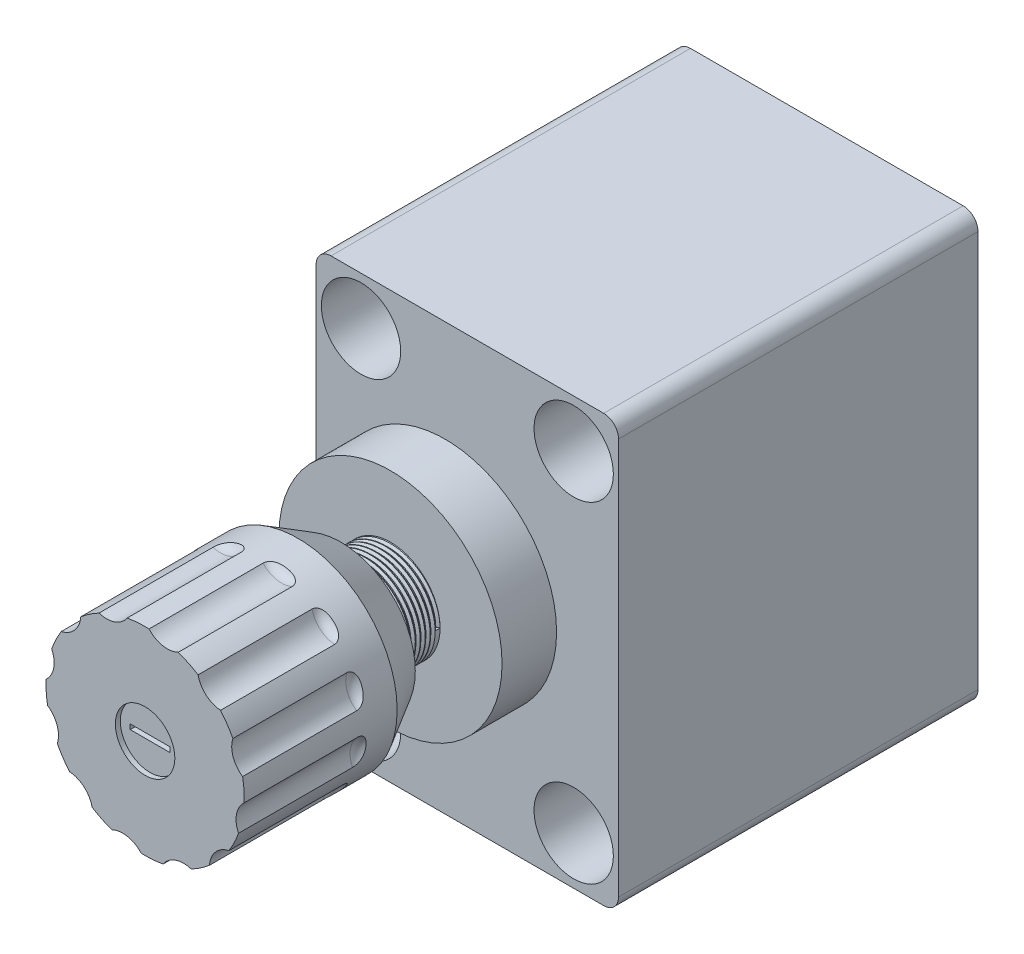
from build123d import *

# Parameters (mm, degrees)
SKETCH_1_W                       = 61
SKETCH_1_H                       = 86
SKETCH_1_R                       = 5
SKETCH_1_R_2                     = 6
SKETCH_1_R_3                     = 3.75
EXTRUDE_1_DEPTH                  = 72.5
SKETCH_3_R                       = 6
SKETCH_3_R_2                     = 3.75
EXTRUDE_2_DEPTH                  = 30
SKETCH_2_R                       = 8
CUT_EXTRUDE_1_DEPTH              = 12
FILLET_1_R                       = 3
SKETCH_7_R                       = 6
CUT_EXTRUDE_2_DEPTH              = 1
SKETCH_8_W                       = 8
SKETCH_8_H                       = 1
CUT_EXTRUDE_3_DEPTH              = 2
THREAD_1_PITCH                   = 1
CUT_EXTRUDE_4_DEPTH              = 25
FILLET_2_R                       = 2
PATTERN_CIRCULAR_1_COUNT         = 12
FILLET_2_OF_PATTERN_CIRCULAR_1_R = 2


with BuildPart() as part:
    # Sketch 1 → 凸台-拉伸1 (new body)
    with BuildSketch(Plane.XY):
        Rectangle(SKETCH_1_W, SKETCH_1_H)
        with Locations((-21.45, 33.35)):
            Circle(SKETCH_1_R, mode=Mode.SUBTRACT)
        with Locations((21.45, 33.35)):
            Circle(SKETCH_1_R, mode=Mode.SUBTRACT)
        with Locations((21.45, -33.35)):
            Circle(SKETCH_1_R, mode=Mode.SUBTRACT)
        with Locations((-21.45, -33.35)):
            Circle(SKETCH_1_R, mode=Mode.SUBTRACT)
        with Locations((-14.35, 0.05)):
            Circle(SKETCH_1_R_2, mode=Mode.SUBTRACT)
        with Locations((14.25, 0.05)):
            Circle(SKETCH_1_R_2, mode=Mode.SUBTRACT)
        with Locations((10.35, -33.35)):
            Circle(SKETCH_1_R_3, mode=Mode.SUBTRACT)
    extrude(amount=-EXTRUDE_1_DEPTH)

    # 草图3 → 凸台-拉伸2 (add)
    with BuildSketch(Plane.XY):
        with Locations((-14.35, 0.05)):
            Circle(SKETCH_3_R)
        with Locations((14.25, 0.05)):
            Circle(SKETCH_3_R)
        with Locations((10.35, -33.35)):
            Circle(SKETCH_3_R_2)
    extrude(amount=-EXTRUDE_2_DEPTH)

    # 草图2 → 切除-拉伸1 (cut)
    with BuildSketch(Plane.XY):
        with Locations((-21.45, 33.35)):
            Circle(SKETCH_2_R)
        with Locations((-21.45, -33.35)):
            Circle(SKETCH_2_R)
        with Locations((21.45, -33.35)):
            Circle(SKETCH_2_R)
        with Locations((21.45, 33.35)):
            Circle(SKETCH_2_R)
    extrude(amount=-CUT_EXTRUDE_1_DEPTH, mode=Mode.SUBTRACT)

    # 草图5 → 旋转1 (revolve)
    with BuildSketch(Plane(origin=(0, 0, 0), x_dir=(0, 0, -1), z_dir=(0, 1, 0))):
        Polygon((0, -18), (-11, -18), (-11, -5.5), (-21, -5.5), (-21, -10.5), (-29.660254038, -15.5), (-60.5, -15.5), (-60.5, 4.5), (0, 4.5), align=None)
    revolve(axis=Axis((-4.5, 0, 85.206195198), (0, 0, -1)))

    # 圆角1
    fillet_1_edges = [part.edges().sort_by_distance(p)[0] for p in [
        (30.5, -43, -36.25),
        (-30.5, -43, -36.25),
        (-30.5, 43, -36.25),
        (30.5, 43, -36.25),
    ]]
    fillet(fillet_1_edges, radius=FILLET_1_R)

    # 草图7 → 切除-拉伸2 (cut)
    with BuildSketch(Plane.XY.offset(60.5)):
        with Locations((-4.5, 0)):
            Circle(SKETCH_7_R)
    extrude(amount=-CUT_EXTRUDE_2_DEPTH, mode=Mode.SUBTRACT)

    # 草图8 → 切除-拉伸3 (cut)
    with BuildSketch(Plane.XY.offset(59.5)):
        with Locations((-4.5, 0)):
            Rectangle(SKETCH_8_W, SKETCH_8_H)
    extrude(amount=-CUT_EXTRUDE_3_DEPTH, mode=Mode.SUBTRACT)

    # 螺纹线1: the profile of Sketch 1 2 profile screwed along a right-hand helix of 15 turns, 8 arcs to a turn; built about Z, then put on its axis
    thread_1_z = Axis((0, 0, 0), (0, 0, 1))
    thread_1_corners = [(10.0003, 0, -0.000173205), (10.0003, 0, 0.875173202), (9.458734125, 0, 0.562499999), (9.458734125, 0, 0.312499999)]
    with BuildLine(mode=Mode.PRIVATE) as thread_1_profile:
        Line(thread_1_corners[0], thread_1_corners[1])
        Line(thread_1_corners[1], thread_1_corners[2])
        Line(thread_1_corners[2], thread_1_corners[3])
        Line(thread_1_corners[3], thread_1_corners[0])
    thread_1_cap = Face(thread_1_profile.wire())
    thread_1_turn_angles = [0, 22.5, 45, 67.5, 90, 112.5, 135, 157.5, 180, 202.5, 225, 247.5, 270, 292.5, 315, 337.5, 360]
    thread_1_turn_weights = [1, 0.9238795325112867, 1, 0.9238795325112867, 1, 0.9238795325112867, 1, 0.9238795325112867, 1, 0.9238795325112867, 1, 0.9238795325112867, 1, 0.9238795325112867, 1, 0.9238795325112867, 1]
    thread_1_turn_rails = [Edge.make_bspline([Vector(p[0], p[1], 0).rotate(thread_1_z, thread_1_turn_angles[k]) / thread_1_turn_weights[k] + Vector(0, 0, p[2] + THREAD_1_PITCH * thread_1_turn_angles[k] / 360) for k in range(17)], [0, 0, 0, 1, 1, 2, 2, 3, 3, 4, 4, 5, 5, 6, 6, 7, 7, 8, 8, 8], 2, thread_1_turn_weights) for p in thread_1_corners]
    thread_1_turn_sides = [Face.make_surface_from_curves(thread_1_turn_rails[p[0]], thread_1_turn_rails[p[1]]) for p in [(0, 1), (1, 2), (2, 3), (3, 0)]]
    thread_1 = Plane(origin=(-4.5, 0, 11), x_dir=(1, 0, 0), z_dir=(0, 0, 1)) * Solid(Shell([*[p.moved(Location((0, 0, THREAD_1_PITCH * i))) for i in range(15) for p in thread_1_turn_sides], thread_1_cap, thread_1_cap.rotate(thread_1_z, 5400).moved(Location((0, 0, THREAD_1_PITCH * 5400 / 360)))]))
    add(thread_1, mode=Mode.SUBTRACT)

    # 草图9 → 切除-拉伸4 (cut)
    with BuildSketch(Plane.XY.offset(60.5)):
        with BuildLine():
            ThreePointArc((-3.702905338, 19.98410969), (-0.946423196, 18.434333512), (2.188628224, 18.848401855))
            ThreePointArc((2.188628224, 18.848401855), (-0.714307216, 19.638445207), (-3.702905338, 19.98410969))
        make_face()
    cut_extrude_4 = extrude(amount=-CUT_EXTRUDE_4_DEPTH, mode=Mode.SUBTRACT)

    # 圆角2
    # the kernel refuses this fillet: 2 mm, written as the material it adds along each edge
    with BuildSketch(Plane(origin=(0, 23.343944814, 35.5), x_dir=(-0.9655082400166618, 0.260372499430965, 0), z_dir=(0.260372499430965, 0.9655082400166618, 0))) as fillet_2_piece_1_section:
        with BuildLine():
            CenterArc((5 - FILLET_2_R, FILLET_2_R), FILLET_2_R, 270, 90)
            Line((5 - FILLET_2_R, 0), (5, 0))
            Line((5, 0), (5, FILLET_2_R))
        make_face()
    fillet_2_piece_1 = revolve(axis=Axis((0, 23.343944814, 35.5), (0, 0, 1)), revolution_arc=188.362253144, mode=Mode.PRIVATE)
    fillet_2_piece_1 = fillet_2_piece_1 & Plane(origin=(-4.5, 0, 36.04735662), x_dir=(1, 0, 0), z_dir=(0, 0, 1)) * Cylinder(20, 21, mode=Mode.PRIVATE)
    add(fillet_2_piece_1)

    # 阵列(圆周)1: 切除-拉伸4 ×12 about axis
    pattern_circular_1_axis = Axis((-4.5, 0, 0), (0, 0, 1))
    for i in range(1, PATTERN_CIRCULAR_1_COUNT):
        add(cut_extrude_4.rotate(pattern_circular_1_axis, i * 360 / PATTERN_CIRCULAR_1_COUNT), mode=Mode.SUBTRACT)

    # 圆角2 of 阵列(圆周)1
    # the kernel refuses this fillet: 2 mm, written as the material it adds along each edge
    with BuildSketch(Plane(origin=(-12.27485809, 22.466449233, 35.5), x_dir=(-0.966340913133115, -0.2572649210542656, 0), z_dir=(-0.2572649210542656, 0.966340913133115, 0))) as fillet_2_of_pattern_circular_1_piece_1_section:
        with BuildLine():
            CenterArc((5 - FILLET_2_OF_PATTERN_CIRCULAR_1_R, FILLET_2_OF_PATTERN_CIRCULAR_1_R), FILLET_2_OF_PATTERN_CIRCULAR_1_R, 270, 90)
            Line((5 - FILLET_2_OF_PATTERN_CIRCULAR_1_R, 0), (5, 0))
            Line((5, 0), (5, FILLET_2_OF_PATTERN_CIRCULAR_1_R))
        make_face()
    fillet_2_of_pattern_circular_1_piece_1 = revolve(axis=Axis((-12.27485809, 22.466449233, 35.5), (0, 0, 1)), revolution_arc=188.362253144, mode=Mode.PRIVATE)
    fillet_2_of_pattern_circular_1_piece_1 = fillet_2_of_pattern_circular_1_piece_1 & Plane(origin=(-4.5, 0, 36.047356638), x_dir=(1, 0, 0), z_dir=(0, 0, 1)) * Cylinder(20, 21, mode=Mode.PRIVATE)
    add(fillet_2_of_pattern_circular_1_piece_1)
    with BuildSketch(Plane(origin=(-22.466449233, 15.569086724, 35.5), x_dir=(-0.7082433189623968, -0.7059684137021492, 0), z_dir=(-0.7059684137021492, 0.7082433189623968, 0))) as fillet_2_of_pattern_circular_1_piece_2_section:
        with BuildLine():
            CenterArc((5 - FILLET_2_OF_PATTERN_CIRCULAR_1_R, FILLET_2_OF_PATTERN_CIRCULAR_1_R), FILLET_2_OF_PATTERN_CIRCULAR_1_R, 270, 90)
            Line((5 - FILLET_2_OF_PATTERN_CIRCULAR_1_R, 0), (5, 0))
            Line((5, 0), (5, FILLET_2_OF_PATTERN_CIRCULAR_1_R))
        make_face()
    fillet_2_of_pattern_circular_1_piece_2 = revolve(axis=Axis((-22.466449233, 15.569086724, 35.5), (0, 0, 1)), revolution_arc=188.362253144, mode=Mode.PRIVATE)
    fillet_2_of_pattern_circular_1_piece_2 = fillet_2_of_pattern_circular_1_piece_2 & Plane(origin=(-4.5, 0, 36.047356638), x_dir=(1, 0, 0), z_dir=(0, 0, 1)) * Cylinder(20, 21, mode=Mode.PRIVATE)
    add(fillet_2_of_pattern_circular_1_piece_2)
    with BuildSketch(Plane(origin=(-27.843944814, 4.5, 35.5), x_dir=(-0.26037249943096574, -0.9655082400166617, 0), z_dir=(-0.9655082400166617, 0.26037249943096574, 0))) as fillet_2_of_pattern_circular_1_piece_3_section:
        with BuildLine():
            CenterArc((5 - FILLET_2_OF_PATTERN_CIRCULAR_1_R, FILLET_2_OF_PATTERN_CIRCULAR_1_R), FILLET_2_OF_PATTERN_CIRCULAR_1_R, 270, 90)
            Line((5 - FILLET_2_OF_PATTERN_CIRCULAR_1_R, 0), (5, 0))
            Line((5, 0), (5, FILLET_2_OF_PATTERN_CIRCULAR_1_R))
        make_face()
    fillet_2_of_pattern_circular_1_piece_3 = revolve(axis=Axis((-27.843944814, 4.5, 35.5), (0, 0, 1)), revolution_arc=188.362253144, mode=Mode.PRIVATE)
    fillet_2_of_pattern_circular_1_piece_3 = fillet_2_of_pattern_circular_1_piece_3 & Plane(origin=(-4.5, 0, 36.047356638), x_dir=(1, 0, 0), z_dir=(0, 0, 1)) * Cylinder(20, 21, mode=Mode.PRIVATE)
    add(fillet_2_of_pattern_circular_1_piece_3)
    with BuildSketch(Plane(origin=(-26.966449233, -7.77485809, 35.5), x_dir=(0.2572649210542635, -0.9663409131331155, 0), z_dir=(-0.9663409131331155, -0.2572649210542635, 0))) as fillet_2_of_pattern_circular_1_piece_4_section:
        with BuildLine():
            CenterArc((5 - FILLET_2_OF_PATTERN_CIRCULAR_1_R, FILLET_2_OF_PATTERN_CIRCULAR_1_R), FILLET_2_OF_PATTERN_CIRCULAR_1_R, 270, 90)
            Line((5 - FILLET_2_OF_PATTERN_CIRCULAR_1_R, 0), (5, 0))
            Line((5, 0), (5, FILLET_2_OF_PATTERN_CIRCULAR_1_R))
        make_face()
    fillet_2_of_pattern_circular_1_piece_4 = revolve(axis=Axis((-26.966449233, -7.77485809, 35.5), (0, 0, 1)), revolution_arc=188.362253144, mode=Mode.PRIVATE)
    fillet_2_of_pattern_circular_1_piece_4 = fillet_2_of_pattern_circular_1_piece_4 & Plane(origin=(-4.5, 0, 36.047356638), x_dir=(1, 0, 0), z_dir=(0, 0, 1)) * Cylinder(20, 21, mode=Mode.PRIVATE)
    add(fillet_2_of_pattern_circular_1_piece_4)
    with BuildSketch(Plane(origin=(-20.069086724, -17.966449233, 35.5), x_dir=(0.7059684137021501, -0.7082433189623958, 0), z_dir=(-0.7082433189623958, -0.7059684137021501, 0))) as fillet_2_of_pattern_circular_1_piece_5_section:
        with BuildLine():
            CenterArc((5 - FILLET_2_OF_PATTERN_CIRCULAR_1_R, FILLET_2_OF_PATTERN_CIRCULAR_1_R), FILLET_2_OF_PATTERN_CIRCULAR_1_R, 270, 90)
            Line((5 - FILLET_2_OF_PATTERN_CIRCULAR_1_R, 0), (5, 0))
            Line((5, 0), (5, FILLET_2_OF_PATTERN_CIRCULAR_1_R))
        make_face()
    fillet_2_of_pattern_circular_1_piece_5 = revolve(axis=Axis((-20.069086724, -17.966449233, 35.5), (0, 0, 1)), revolution_arc=188.362253144, mode=Mode.PRIVATE)
    fillet_2_of_pattern_circular_1_piece_5 = fillet_2_of_pattern_circular_1_piece_5 & Plane(origin=(-4.5, 0, 36.047356638), x_dir=(1, 0, 0), z_dir=(0, 0, 1)) * Cylinder(20, 21, mode=Mode.PRIVATE)
    add(fillet_2_of_pattern_circular_1_piece_5)
    with BuildSketch(Plane(origin=(-9, -23.343944814, 35.5), x_dir=(0.9655082400166618, -0.260372499430965, 0), z_dir=(-0.260372499430965, -0.9655082400166618, 0))) as fillet_2_of_pattern_circular_1_piece_6_section:
        with BuildLine():
            CenterArc((5 - FILLET_2_OF_PATTERN_CIRCULAR_1_R, FILLET_2_OF_PATTERN_CIRCULAR_1_R), FILLET_2_OF_PATTERN_CIRCULAR_1_R, 270, 90)
            Line((5 - FILLET_2_OF_PATTERN_CIRCULAR_1_R, 0), (5, 0))
            Line((5, 0), (5, FILLET_2_OF_PATTERN_CIRCULAR_1_R))
        make_face()
    fillet_2_of_pattern_circular_1_piece_6 = revolve(axis=Axis((-9, -23.343944814, 35.5), (0, 0, 1)), revolution_arc=188.362253144, mode=Mode.PRIVATE)
    fillet_2_of_pattern_circular_1_piece_6 = fillet_2_of_pattern_circular_1_piece_6 & Plane(origin=(-4.5, 0, 36.047356638), x_dir=(1, 0, 0), z_dir=(0, 0, 1)) * Cylinder(20, 21, mode=Mode.PRIVATE)
    add(fillet_2_of_pattern_circular_1_piece_6)
    with BuildSketch(Plane(origin=(3.27485809, -22.466449233, 35.5), x_dir=(0.9663409131331152, 0.2572649210542648, 0), z_dir=(0.2572649210542648, -0.9663409131331152, 0))) as fillet_2_of_pattern_circular_1_piece_7_section:
        with BuildLine():
            CenterArc((5 - FILLET_2_OF_PATTERN_CIRCULAR_1_R, FILLET_2_OF_PATTERN_CIRCULAR_1_R), FILLET_2_OF_PATTERN_CIRCULAR_1_R, 270, 90)
            Line((5 - FILLET_2_OF_PATTERN_CIRCULAR_1_R, 0), (5, 0))
            Line((5, 0), (5, FILLET_2_OF_PATTERN_CIRCULAR_1_R))
        make_face()
    fillet_2_of_pattern_circular_1_piece_7 = revolve(axis=Axis((3.27485809, -22.466449233, 35.5), (0, 0, 1)), revolution_arc=188.362253144, mode=Mode.PRIVATE)
    fillet_2_of_pattern_circular_1_piece_7 = fillet_2_of_pattern_circular_1_piece_7 & Plane(origin=(-4.5, 0, 36.047356638), x_dir=(1, 0, 0), z_dir=(0, 0, 1)) * Cylinder(20, 20, mode=Mode.PRIVATE)
    add(fillet_2_of_pattern_circular_1_piece_7)
    with BuildSketch(Plane(origin=(13.466449233, -15.569086724, 35.5), x_dir=(0.7082433189623967, 0.7059684137021491, 0), z_dir=(0.7059684137021491, -0.7082433189623967, 0))) as fillet_2_of_pattern_circular_1_piece_8_section:
        with BuildLine():
            CenterArc((5 - FILLET_2_OF_PATTERN_CIRCULAR_1_R, FILLET_2_OF_PATTERN_CIRCULAR_1_R), FILLET_2_OF_PATTERN_CIRCULAR_1_R, 270, 90)
            Line((5 - FILLET_2_OF_PATTERN_CIRCULAR_1_R, 0), (5, 0))
            Line((5, 0), (5, FILLET_2_OF_PATTERN_CIRCULAR_1_R))
        make_face()
    fillet_2_of_pattern_circular_1_piece_8 = revolve(axis=Axis((13.466449233, -15.569086724, 35.5), (0, 0, 1)), revolution_arc=188.362253144, mode=Mode.PRIVATE)
    fillet_2_of_pattern_circular_1_piece_8 = fillet_2_of_pattern_circular_1_piece_8 & Plane(origin=(-4.5, 0, 36.047356638), x_dir=(1, 0, 0), z_dir=(0, 0, 1)) * Cylinder(20, 20, mode=Mode.PRIVATE)
    add(fillet_2_of_pattern_circular_1_piece_8)
    with BuildSketch(Plane(origin=(18.843944814, -4.5, 35.5), x_dir=(0.2603724994309651, 0.965508240016662, 0), z_dir=(0.965508240016662, -0.2603724994309651, 0))) as fillet_2_of_pattern_circular_1_piece_9_section:
        with BuildLine():
            CenterArc((5 - FILLET_2_OF_PATTERN_CIRCULAR_1_R, FILLET_2_OF_PATTERN_CIRCULAR_1_R), FILLET_2_OF_PATTERN_CIRCULAR_1_R, 270, 90)
            Line((5 - FILLET_2_OF_PATTERN_CIRCULAR_1_R, 0), (5, 0))
            Line((5, 0), (5, FILLET_2_OF_PATTERN_CIRCULAR_1_R))
        make_face()
    fillet_2_of_pattern_circular_1_piece_9 = revolve(axis=Axis((18.843944814, -4.5, 35.5), (0, 0, 1)), revolution_arc=188.362253144, mode=Mode.PRIVATE)
    fillet_2_of_pattern_circular_1_piece_9 = fillet_2_of_pattern_circular_1_piece_9 & Plane(origin=(-4.5, 0, 36.047356638), x_dir=(1, 0, 0), z_dir=(0, 0, 1)) * Cylinder(20, 21, mode=Mode.PRIVATE)
    add(fillet_2_of_pattern_circular_1_piece_9)
    with BuildSketch(Plane(origin=(17.966449233, 7.77485809, 35.5), x_dir=(-0.2572649210542648, 0.9663409131331152, 0), z_dir=(0.9663409131331152, 0.2572649210542648, 0))) as fillet_2_of_pattern_circular_1_piece_10_section:
        with BuildLine():
            CenterArc((5 - FILLET_2_OF_PATTERN_CIRCULAR_1_R, FILLET_2_OF_PATTERN_CIRCULAR_1_R), FILLET_2_OF_PATTERN_CIRCULAR_1_R, 270, 90)
            Line((5 - FILLET_2_OF_PATTERN_CIRCULAR_1_R, 0), (5, 0))
            Line((5, 0), (5, FILLET_2_OF_PATTERN_CIRCULAR_1_R))
        make_face()
    fillet_2_of_pattern_circular_1_piece_10 = revolve(axis=Axis((17.966449233, 7.77485809, 35.5), (0, 0, 1)), revolution_arc=188.362253144, mode=Mode.PRIVATE)
    fillet_2_of_pattern_circular_1_piece_10 = fillet_2_of_pattern_circular_1_piece_10 & Plane(origin=(-4.5, 0, 36.047356638), x_dir=(1, 0, 0), z_dir=(0, 0, 1)) * Cylinder(20, 21, mode=Mode.PRIVATE)
    add(fillet_2_of_pattern_circular_1_piece_10)
    with BuildSketch(Plane(origin=(11.069086724, 17.966449233, 35.5), x_dir=(-0.7059684137021495, 0.7082433189623966, 0), z_dir=(0.7082433189623966, 0.7059684137021495, 0))) as fillet_2_of_pattern_circular_1_piece_11_section:
        with BuildLine():
            CenterArc((5 - FILLET_2_OF_PATTERN_CIRCULAR_1_R, FILLET_2_OF_PATTERN_CIRCULAR_1_R), FILLET_2_OF_PATTERN_CIRCULAR_1_R, 270, 90)
            Line((5 - FILLET_2_OF_PATTERN_CIRCULAR_1_R, 0), (5, 0))
            Line((5, 0), (5, FILLET_2_OF_PATTERN_CIRCULAR_1_R))
        make_face()
    fillet_2_of_pattern_circular_1_piece_11 = revolve(axis=Axis((11.069086724, 17.966449233, 35.5), (0, 0, 1)), revolution_arc=188.362253144, mode=Mode.PRIVATE)
    fillet_2_of_pattern_circular_1_piece_11 = fillet_2_of_pattern_circular_1_piece_11 & Plane(origin=(-4.5, 0, 36.047356638), x_dir=(1, 0, 0), z_dir=(0, 0, 1)) * Cylinder(20, 21, mode=Mode.PRIVATE)
    add(fillet_2_of_pattern_circular_1_piece_11)


solid = part.part
